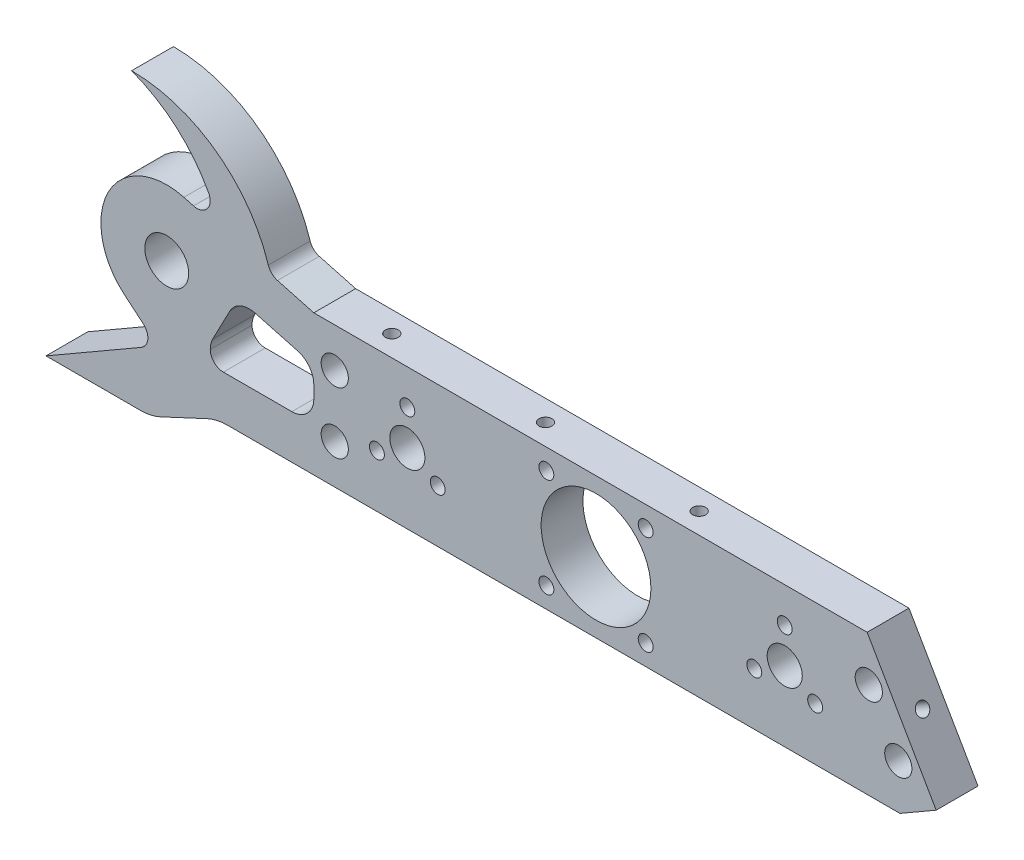
from build123d import *

# Parameters (mm, degrees)
SKETCH1_R                           = 5
INITIAL_BODY_DEPTH                  = 4.7625
SKETCH2_R                           = 12.5
SKETCH2_R_2                         = 1.7
SKETCH2_R_3                         = 4
DRIVE_MOUNTING_HOLES_DEPTH          = 116.797997608
FILLET1_R                           = 12
BACKPLATE_MOUNTING_PROTRUSION_DEPTH = 9.525
SKETCH4_R                           = 3.1
BACKPLATE_MOUNTING_HOLES_DEPTH      = 116.797997608
SKETCH5_R                           = 3.1
FRONTPLATE_MOUNTING_HOLES_DEPTH     = 116.797997608
F_32_HOLE_PATTERN_COUNT             = 4
F_32_HOLE_PATTERN_PITCH             = 36
LPATTERN2_COUNT                     = 3
LPATTERN2_PITCH                     = 35
CUT_EXTRUDE3_DEPTH                  = 116.797997608
FILLET2_R                           = 5
FILLET3_R                           = 3
BOSS_EXTRUDE1_DEPTH                 = 9.525
FILLET4_R                           = 11
FILLET5_R                           = 3
BOSS_EXTRUDE2_DEPTH                 = 9.525
FILLET6_R                           = 3
SKETCH19_R                          = 1.475
CUT_EXTRUDE4_DEPTH                  = 9.525


with BuildPart() as part:
    # Sketch1 → Initial Body (new, symmetric)
    with BuildSketch(Plane.XY):
        with BuildLine():
            Line((-93.868600914, 23.98240471), (-64.275, 16))
            Line((-64.275, 16), (-54.75, 16))
            Line((-54.75, 16), (61.75, 16))
            Line((61.75, 16), (61.75, -16))
            Line((61.75, -16), (-54.75, -16))
            Line((-54.75, -16), (-90.721140792, -16))
            Line((-90.721140792, -16), (-107.416814145, -1.990666647))
            ThreePointArc((-107.416814145, -1.990666647), (-111.074393046, 16.437300959), (-93.868600914, 23.98240471))
        make_face()
        with Locations(Location((-97.775, 9.5, 0), (0, 0, 180))):
            Circle(SKETCH1_R, mode=Mode.SUBTRACT)
    extrude(amount=INITIAL_BODY_DEPTH, both=True)

    # Sketch2 → Drive Mounting Holes (cut, through all)
    with BuildSketch(Plane.XY.offset(4.7625)):
        Circle(SKETCH2_R)
        with Locations((-11.313708499, 11.313708499)):
            Circle(SKETCH2_R_2)
        with Locations((-11.313708499, -11.313708499)):
            Circle(SKETCH2_R_2)
        with Locations((11.313708499, 11.313708499)):
            Circle(SKETCH2_R_2)
        with Locations((11.313708499, -11.313708499)):
            Circle(SKETCH2_R_2)
        with Locations((49.907333067, -4)):
            Circle(SKETCH2_R_2)
        with Locations((42.979129837, 8)):
            Circle(SKETCH2_R_2)
        with Locations((36.050926606, -4)):
            Circle(SKETCH2_R_2)
        with Locations((42.979129837, 0)):
            Circle(SKETCH2_R_3)
        with Locations((-42.979123237, 8)):
            Circle(SKETCH2_R_2)
        with Locations((-49.907326467, -4)):
            Circle(SKETCH2_R_2)
        with Locations((-42.979123237, 0)):
            Circle(SKETCH2_R_3)
        with Locations((-36.050920006, -4)):
            Circle(SKETCH2_R_2)
    extrude(amount=-DRIVE_MOUNTING_HOLES_DEPTH, mode=Mode.SUBTRACT)

    # Fillet1
    fillet1_edges = [part.edges().sort_by_distance(p)[0] for p in [
        (-90.721140792, -16, 0),
    ]]
    fillet(fillet1_edges, radius=FILLET1_R)

    # Sketch3 → Backplate Mounting Protrusion (add)
    with BuildSketch(Plane.XY.offset(4.7625)):
        Polygon((61.75, 16), (77.475577957, -11.2375), (69.226685986, -16), (61.75, -16), align=None)
    extrude(amount=-BACKPLATE_MOUNTING_PROTRUSION_DEPTH)

    # Sketch4 → Backplate Mounting Holes (cut, through all)
    with BuildSketch(Plane.XY.offset(4.7625)):
        with Locations((68.851131972, -5.824521366)):
            Circle(SKETCH4_R)
        with Locations((62.125554014, 5.824521366)):
            Circle(SKETCH4_R)
    extrude(amount=-BACKPLATE_MOUNTING_HOLES_DEPTH, mode=Mode.SUBTRACT)

    # Sketch5 → Frontplate Mounting Holes (cut, through all)
    with BuildSketch(Plane.XY.offset(4.7625)):
        with Locations((-59.5125, -7)):
            Circle(SKETCH5_R)
        with Locations((-59.5125, 7)):
            Circle(SKETCH5_R)
    extrude(amount=-FRONTPLATE_MOUNTING_HOLES_DEPTH, mode=Mode.SUBTRACT)

    # Sketch9 → #32 (0.116) Diameter Hole1 (revolve, cut)
    with BuildSketch(Plane(origin=(54.226685986, -16, 0), x_dir=(0, 0, -1), z_dir=(1, 0, 0))):
        Polygon((0, 0), (0, 13.585187864), (1.4732, 12.7), (1.4732, 0), align=None)
    f_32_0_116_diameter_hole1 = revolve(axis=Axis((54.226685986, -22.35, 0), (0, 1, 0)), mode=Mode.SUBTRACT)

    # #32 Hole Pattern: #32 (0.116) Diameter Hole1 ×4
    with Locations(*[(-i * F_32_HOLE_PATTERN_PITCH, 0, 0) for i in range(1, F_32_HOLE_PATTERN_COUNT)]):
        add(f_32_0_116_diameter_hole1, mode=Mode.SUBTRACT)

    # Sketch13 → #32 (0.116) Diameter Hole2 (revolve, cut)
    with BuildSketch(Plane(origin=(-51.275, 16, 0), x_dir=(0, 0, 1), z_dir=(1, 0, 0))):
        Polygon((0, 0), (0, 13.585187864), (1.4732, 12.7), (1.4732, 0), align=None)
    f_32_0_116_diameter_hole2 = revolve(axis=Axis((-51.275, 22.35, 0), (0, -1, 0)), mode=Mode.SUBTRACT)

    # LPattern2: #32 (0.116) Diameter Hole2 ×3
    with Locations(*[(i * LPATTERN2_PITCH, 0, 0) for i in range(1, LPATTERN2_COUNT)]):
        add(f_32_0_116_diameter_hole2, mode=Mode.SUBTRACT)

    # Sketch16 → Cut-Extrude3 (cut, through all)
    with BuildSketch(Plane.XY.offset(4.7625)):
        Polygon((-81.56431208, 10.306121895), (-89.160154233, -4.255750352), (-87.081438449, -6), (-64.275, -6), (-64.275, 5.642604042), align=None)
    extrude(amount=-CUT_EXTRUDE3_DEPTH, mode=Mode.SUBTRACT)

    # Fillet2
    # the kernel refuses this fillet: 5 mm, written as the material it adds along each edge
    with BuildSketch(Plane(origin=(-87.081438449, -6, 4.7625), x_dir=(1, 0, 0), z_dir=(0, 0, -1))) as fillet2_piece_1:
        with BuildLine():
            CenterArc((FILLET2_R * 0.363970234266, -FILLET2_R), FILLET2_R, 90, 40)
            Line((-FILLET2_R * 0.27881737542, -FILLET2_R * 0.233955556881), (0, 0))
            Line((0, 0), (FILLET2_R * 0.363970234266, 0))
        make_face()
    extrude(amount=9.525)
    with BuildSketch(Plane(origin=(-81.56431208, 10.306121895, 4.7625), x_dir=(-0.46248673062374396, -0.8866262030850207, 0), z_dir=(0, 0, -1))) as fillet2_piece_2:
        with BuildLine():
            CenterArc((FILLET2_R * 0.803269307158, -FILLET2_R), FILLET2_R, 90, 77.547688459)
            Line((-FILLET2_R * 0.173206508928, -FILLET2_R * 0.784373052244), (0, 0))
            Line((0, 0), (FILLET2_R * 0.803269307158, 0))
        make_face()
    extrude(amount=9.525)
    with BuildSketch(Plane(origin=(-64.275, 5.642604042, 4.7625), x_dir=(-0.9654936473229752, 0.2604266057433045, 0), z_dir=(0, 0, -1))) as fillet2_piece_3:
        with BuildLine():
            CenterArc((FILLET2_R * 0.766005448412, -FILLET2_R), FILLET2_R, 90, 74.904623082)
            Line((-FILLET2_R * 0.199488198911, -FILLET2_R * 0.739573394257), (0, 0))
            Line((0, 0), (FILLET2_R * 0.766005448412, 0))
        make_face()
    extrude(amount=9.525)
    with BuildSketch(Plane(origin=(-64.275, -6, 4.7625), x_dir=(0, 1, 0), z_dir=(0, 0, -1))) as fillet2_piece_4:
        with BuildLine():
            CenterArc((FILLET2_R, -FILLET2_R), FILLET2_R, 90, 90)
            Line((0, -FILLET2_R), (0, 0))
            Line((0, 0), (FILLET2_R, 0))
        make_face()
    extrude(amount=9.525)
    with BuildSketch(Plane(origin=(-89.160154233, -4.255750352, 4.7625), x_dir=(0.46248673062374385, 0.8866262030850208, 0), z_dir=(0, 0, -1))) as fillet2_piece_5:
        with BuildLine():
            CenterArc((FILLET2_R * 0.803269307158, FILLET2_R), FILLET2_R, 192.452311541, 77.547688459)
            Line((-FILLET2_R * 0.173206508928, FILLET2_R * 0.784373052244), (0, 0))
            Line((0, 0), (FILLET2_R * 0.803269307158, 0))
        make_face()
    extrude(amount=9.525)

    # Fillet3
    fillet3_edges = [part.edges().sort_by_distance(p)[0] for p in [
        (-87.118779386, -5.642287957, 0),
    ]]
    fillet(fillet3_edges, radius=FILLET3_R)

    # Sketch17 → Boss-Extrude1 (add)
    with BuildSketch(Plane.XY.offset(4.7625)):
        Polygon((-99.863490205, -8.328657979), (-125.275, -23), (-101.365046424, -23), (-86.353497981, -16), align=None)
    extrude(amount=-BOSS_EXTRUDE1_DEPTH)

    # Fillet4
    fillet4_edges = [part.edges().sort_by_distance(p)[0] for p in [
        (-101.365046424, -23, 0),
        (-86.353497981, -16, 0),
    ]]
    fillet(fillet4_edges, radius=FILLET4_R)

    # Fillet5
    fillet5_edges = [part.edges().sort_by_distance(p)[0] for p in [
        (-99.863490205, -8.328657979, 0),
    ]]
    fillet(fillet5_edges, radius=FILLET5_R)

    # Sketch18 → Boss-Extrude2 (add)
    with BuildSketch(Plane.XY.offset(4.7625)):
        with BuildLine():
            Line((-74.189076232, 18.674164899), (-85.775, 21.799284168))
            ThreePointArc((-85.775, 21.799284168), (-93.307626122, 34.727274696), (-105.775, 43))
            ThreePointArc((-105.775, 43), (-85.841254531, 36.213690245), (-74.189076232, 18.674164899))
        make_face()
    extrude(amount=-BOSS_EXTRUDE2_DEPTH)

    # Fillet6
    fillet6_edges = [part.edges().sort_by_distance(p)[0] for p in [
        (-85.775, 21.799284168, 0),
        (-74.189076232, 18.674164899, 0),
    ]]
    fillet(fillet6_edges, radius=FILLET6_R)

    # Sketch19 → Cut-Extrude4 (cut)
    with BuildSketch(Plane(origin=(53.24070323, 30.738534342, 0), x_dir=(0, 0, -1), z_dir=(0.8660254037844396, 0.4999999999999983, 0))):
        with Locations(Location((0, -32.744171497, 0), (0, 0, 90))):
            Circle(SKETCH19_R)
    extrude(amount=-CUT_EXTRUDE4_DEPTH, mode=Mode.SUBTRACT)


solid = part.part
